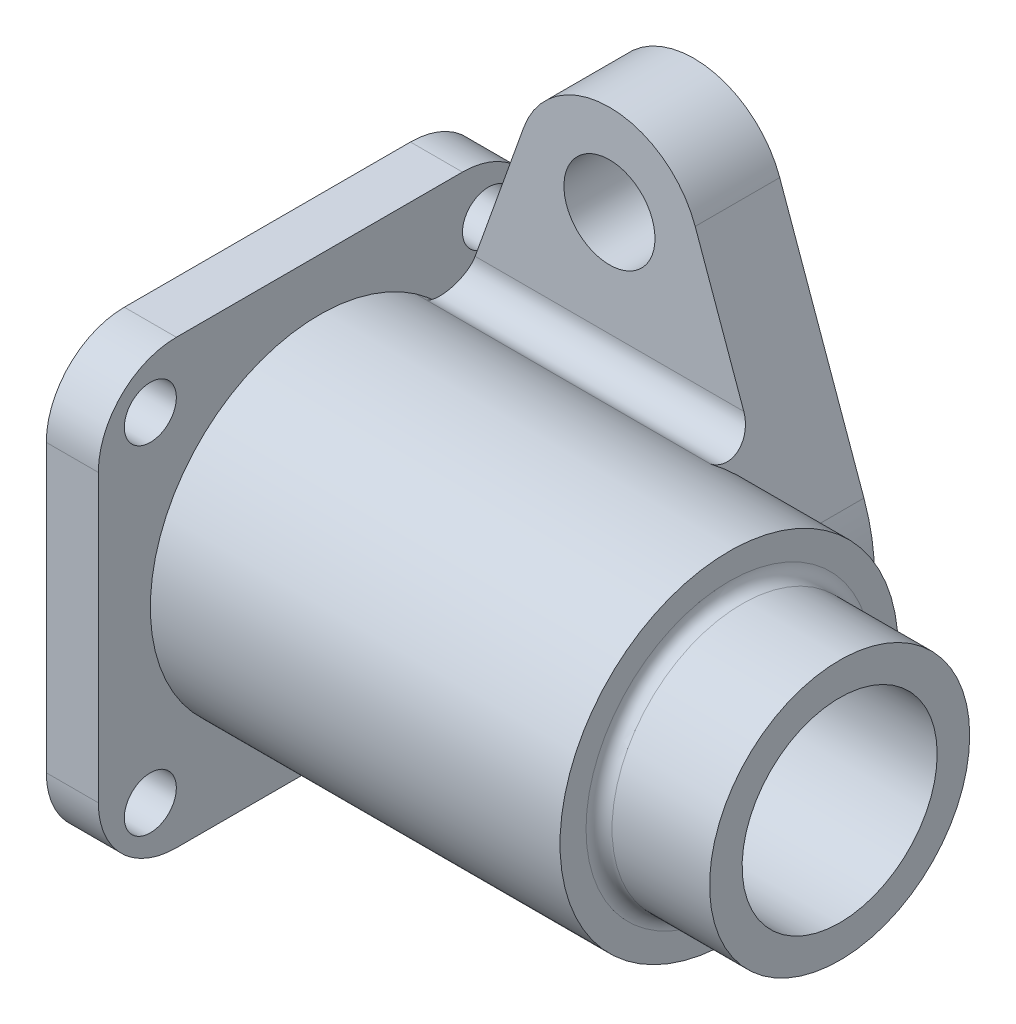
from build123d import *

# Parameters (mm, degrees)
SKETCH1_R           = 7
SKETCH1_R_2         = 15
BOSS_EXTRUDE1_DEPTH = 13
SKETCH2_R           = 4
BOSS_EXTRUDE2_DEPTH = 4
SKETCH5_R           = 26
BOSS_EXTRUDE3_DEPTH = 63
FILLET6_R           = 4
FILLET7_R           = 4
SKETCH6_R           = 21
CUT_EXTRUDE1_DEPTH  = 22
CUT_EXTRUDE2_REACH  = 93.894
SKETCH7_R           = 15
BOSS_EXTRUDE4_START = -43
SKETCH9_R           = 15
BOSS_EXTRUDE4_DEPTH = 43
FILLET10_R          = 2
SKETCH12_R          = 20
BOSS_EXTRUDE5_DEPTH = 17
FILLET14_R          = 2
CUT_EXTRUDE4_REACH  = 119.421
SKETCH16_R          = 15
CUT_EXTRUDE5_REACH  = 106.103
SKETCH17_R          = 15
FILLET17_R          = 5


with BuildPart() as part:
    # Sketch1 → Boss-Extrude1 (new body)
    with BuildSketch(Plane.XY):
        with BuildLine():
            Line((-13.182592111, 45.551865312), (-26.129780791, 9.343289347))
            ThreePointArc((-26.129780791, 9.343289347), (-27.749182892, -0.212952692), (-25.983307196, -9.743215442))
            Line((-25.983307196, -9.743215442), (-13.108695522, -44.07736233))
            ThreePointArc((-13.108695522, -44.07736233), (0, -53.161866251), (13.108695522, -44.07736233))
            Line((13.108695522, -44.07736233), (25.983307196, -9.743215442))
            ThreePointArc((25.983307196, -9.743215442), (27.749182892, -0.212952692), (26.129780791, 9.343289347))
            Line((26.129780791, 9.343289347), (13.182592111, 45.551865312))
            ThreePointArc((13.182592111, 45.551865312), (0, 54.838133749), (-13.182592111, 45.551865312))
        make_face()
        with Locations((0, 40.838133749)):
            Circle(SKETCH1_R, mode=Mode.SUBTRACT)
        with Locations((0, -39.161866251)):
            Circle(SKETCH1_R, mode=Mode.SUBTRACT)
        Circle(SKETCH1_R_2, mode=Mode.SUBTRACT)
    extrude(amount=-BOSS_EXTRUDE1_DEPTH)



with BuildPart() as body_2:
    # Sketch2 → Boss-Extrude2 (new, symmetric)
    with BuildSketch(Plane(origin=(-27.5, 0, 0), x_dir=(0, 0, -1), z_dir=(1, 0, 0))):
        with BuildLine():
            Line((-43.103277086, 34), (0.896722914, 34))
            ThreePointArc((0.896722914, 34), (9.382004289, 30.485281374), (12.896722914, 22))
            Line((12.896722914, 22), (12.896722914, -22))
            ThreePointArc((12.896722914, -22), (9.382004289, -30.485281374), (0.896722914, -34))
            Line((0.896722914, -34), (-43.103277086, -34))
            ThreePointArc((-43.103277086, -34), (-51.58855846, -30.485281374), (-55.103277086, -22))
            Line((-55.103277086, -22), (-55.103277086, 22))
            ThreePointArc((-55.103277086, 22), (-51.58855846, 30.485281374), (-43.103277086, 34))
        make_face()
        with Locations((-47.103277086, 26)):
            Circle(SKETCH2_R, mode=Mode.SUBTRACT)
        with Locations((-47.103277086, -26)):
            Circle(SKETCH2_R, mode=Mode.SUBTRACT)
        with Locations((4.896722914, 26)):
            Circle(SKETCH2_R, mode=Mode.SUBTRACT)
        with Locations((4.896722914, -26)):
            Circle(SKETCH2_R, mode=Mode.SUBTRACT)
    extrude(amount=BOSS_EXTRUDE2_DEPTH, both=True)


with BuildPart() as part_1:
    add(part.part)

    add(body_2.part)  # Boss-Extrude3 merges body 2
    # Sketch5 → Boss-Extrude3 (add)
    with BuildSketch(Plane(origin=(-23.5, 0, 0), x_dir=(0, 0, -1), z_dir=(1, 0, 0))):
        with Locations(Location((-21.103277086, 0, 0), (0, 0, 324.258878137))):
            Circle(SKETCH5_R)
    extrude(amount=BOSS_EXTRUDE3_DEPTH)

    # Fillet6
    # the kernel refuses this fillet: 4 mm, written as the material it adds along each edge
    with BuildSketch(Plane(origin=(-47.149613866, -15.187221479, 0), x_dir=(0, -0.701013336910265, 0.7131481623575392), z_dir=(1, 0, 0))) as fillet6_piece_1_section:
        with BuildLine():
            CenterArc((9.484070542, 3.94221812), FILLET6_R, 135.491639194, 124.757843476)
            Line((6.631477893, 6.746271467), (0, 0))
            ThreePointArc((0, 0), (4.403318466, 0.375582222), (8.806636932, 0))
        make_face()
    fillet6_piece_1 = extrude(amount=94.74114261, mode=Mode.PRIVATE)
    fillet6_piece_1 = split(fillet6_piece_1, bisect_by=Plane(origin=(19.603312595, -26.757450692, 1.537679947), z_dir=(-0.9363353944532133, 0.35110686278417497, 0)), keep=Keep.TOP, mode=Mode.PRIVATE)
    fillet6_piece_1 = split(fillet6_piece_1, bisect_by=Plane(origin=(-19.602415947, -26.759841882, 1.537679947), z_dir=(0.9363353944532126, 0.35110686278417685, 0)), keep=Keep.TOP, mode=Mode.PRIVATE)
    add(fillet6_piece_1)

    # Fillet7
    # the kernel refuses this fillet: 4 mm, written as the material it adds along each edge
    with BuildSketch(Plane(origin=(47.689765613, 15.187221479, 0), x_dir=(0, 1, 0), z_dir=(-1, 0, 0))) as fillet7_piece_1_section:
        with BuildLine():
            CenterArc((9.459845546, -4), FILLET7_R, 90, 124.757843476)
            ThreePointArc((6.173569943, -6.280436945), (3.354630742, -2.876930326), (0, 0))
            Line((0, 0), (9.459845546, 0))
        make_face()
    fillet7_piece_1 = extrude(amount=94.839379478, mode=Mode.PRIVATE)
    fillet7_piece_1 = split(fillet7_piece_1, bisect_by=Plane(origin=(-19.975054308, 26.555819952, 1.538101515), z_dir=(0.941613722197052, -0.33669511159239174, 0)), keep=Keep.TOP, mode=Mode.PRIVATE)
    fillet7_piece_1 = split(fillet7_piece_1, bisect_by=Plane(origin=(19.97656332, 26.551599793, 1.538101515), z_dir=(-0.9416137221970524, -0.3366951115923907, 0)), keep=Keep.TOP, mode=Mode.PRIVATE)
    add(fillet7_piece_1)

    # Sketch6 → Cut-Extrude1 (cut)
    with BuildSketch(Plane.ZY.offset(31.5)):
        with Locations((21.103277086, 0)):
            Circle(SKETCH6_R)
    extrude(amount=-CUT_EXTRUDE1_DEPTH, mode=Mode.SUBTRACT)

    # Sketch7 → Cut-Extrude2 (cut, up to next)
    with BuildSketch(Plane.ZY.offset(9.5), mode=Mode.PRIVATE) as cut_extrude2_sk1:
        with Locations((21.103277086, 0)):
            Circle(SKETCH7_R)
    cut_extrude2_tool1 = extrude(cut_extrude2_sk1.sketch, amount=-CUT_EXTRUDE2_REACH, mode=Mode.PRIVATE) & part_1.part
    add(cut_extrude2_tool1.solids().sort_by_distance((-9.5, 0, 21.103277))[0], mode=Mode.SUBTRACT)

    # Sketch9 → Boss-Extrude4 (add)
    with BuildSketch(Plane(origin=(39.5, 0, 0), x_dir=(0, 0, -1), z_dir=(1, 0, 0)).offset(BOSS_EXTRUDE4_START)):
        with Locations(Location((-21.103277086, 0, 0), (0, 0, 180))):
            Circle(SKETCH9_R)
    extrude(amount=BOSS_EXTRUDE4_DEPTH)

    # Fillet10
    fillet10_edges = [part_1.edges().sort_by_distance(p)[0] for p in [
        (-31.5, 0, 0.103277086),
    ]]
    fillet(fillet10_edges, radius=FILLET10_R)

    # Sketch12 → Boss-Extrude5 (add)
    with BuildSketch(Plane(origin=(39.5, 0, 0), x_dir=(0, 0, -1), z_dir=(1, 0, 0))):
        with Locations((-21.103277086, 0)):
            Circle(SKETCH12_R)
    extrude(amount=BOSS_EXTRUDE5_DEPTH)

    # Fillet14
    fillet14_edges = [part_1.edges().sort_by_distance(p)[0] for p in [
        (39.5, 0, 41.103277086),
    ]]
    fillet(fillet14_edges, radius=FILLET14_R)

    # Sketch16 → Cut-Extrude4 (cut, up to next)
    with BuildSketch(Plane(origin=(56.5, 0, 0), x_dir=(0, 0, -1), z_dir=(1, 0, 0)), mode=Mode.PRIVATE) as cut_extrude4_sk1:
        with Locations(Location((-21.103277086, 0, 0), (0, 0, 180))):
            Circle(SKETCH16_R)
    cut_extrude4_tool1 = extrude(cut_extrude4_sk1.sketch, amount=-CUT_EXTRUDE4_REACH, mode=Mode.PRIVATE) & part_1.part
    add(cut_extrude4_tool1.solids().sort_by_distance((56.5, 0, 21.103277))[0], mode=Mode.SUBTRACT)

    # Sketch17 → Cut-Extrude5 (cut, up to next)
    with BuildSketch(Plane(origin=(0, 0, -13), x_dir=(-1, 0, 0), z_dir=(0, 0, -1)), mode=Mode.PRIVATE) as cut_extrude5_sk1:
        with Locations(Location((0, 0, 0), (0, 0, 180))):
            Circle(SKETCH17_R)
    cut_extrude5_tool1 = extrude(cut_extrude5_sk1.sketch, amount=-CUT_EXTRUDE5_REACH, mode=Mode.PRIVATE) & part_1.part
    add(cut_extrude5_tool1.solids().sort_by_distance((0, 0, -13))[0], mode=Mode.SUBTRACT)

    # Fillet17
    fillet17_edges = [part_1.edges().sort_by_distance(p)[0] for p in [
        (-15, 0, -13),
    ]]
    fillet(fillet17_edges, radius=FILLET17_R)


solid = part_1.part
